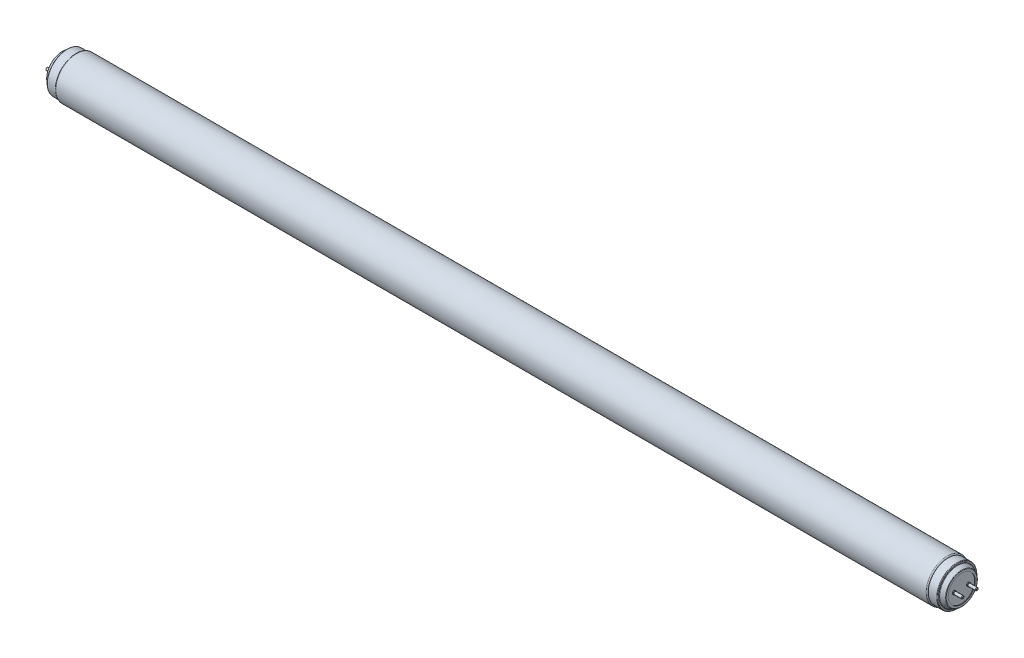
from build123d import *

# Parameters (mm, degrees)
SKETCH2_R      = 1.2
EXTRUDE1_DEPTH = 8
SKETCH3_R      = 1.5
EXTRUDE2_DEPTH = 1
EXTRUDE3_START = 8
SKETCH4_R      = 1.2
EXTRUDE3_DEPTH = 8
EXTRUDE4_START = 1
SKETCH5_R      = 1.5
EXTRUDE4_DEPTH = 1
CHAMFER1_SIZE  = 0.3
CHAMFER2_SIZE  = 0.5


with BuildPart() as part:
    # Sketch1 → Revolve1 (revolve)
    with BuildSketch(Plane.XY, mode=Mode.PRIVATE) as revolve1_sk:
        with BuildLine():
            Line((0, -17.75), (-7.5, -17.75))
            ThreePointArc((-7.5, -17.75), (-7.853553391, -17.603553391), (-8, -17.25))
            Line((-8, -17.25), (-8, -16.309016994))
            ThreePointArc((-8, -16.309016994), (-8.074674596, -16.046151438), (-8.276393202, -15.861803399))
            Line((-8.276393202, -15.861803399), (-11.723606798, -14.138196601))
            ThreePointArc((-11.723606798, -14.138196601), (-11.925325404, -13.953848562), (-12, -13.690983006))
            Line((-12, -13.690983006), (-12, -12))
            Line((-12, -12), (-11.5, -12))
            Line((-11.5, -12), (-11.5, 0))
            Line((-11.5, 0), (0, 0))
            Line((0, 0), (776, 0))
            Line((776, 0), (787.5, 0))
            Line((787.5, 0), (787.5, -12))
            Line((787.5, -12), (788, -12))
            Line((788, -12), (788, -13.690983006))
            ThreePointArc((788, -13.690983006), (787.925325404, -13.953848562), (787.723606798, -14.138196601))
            Line((787.723606798, -14.138196601), (784.276393202, -15.861803399))
            ThreePointArc((784.276393202, -15.861803399), (784.074674596, -16.046151438), (784, -16.309016994))
            Line((784, -16.309016994), (784, -17.25))
            ThreePointArc((784, -17.25), (783.853553391, -17.603553391), (783.5, -17.75))
            Line((783.5, -17.75), (776, -17.75))
            ThreePointArc((776, -17.75), (775.721751442, -18.421751442), (775.05, -18.7))
            Line((775.05, -18.7), (0.95, -18.7))
            ThreePointArc((0.95, -18.7), (0.278248558, -18.421751442), (0, -17.75))
        make_face()
    revolve(revolve1_sk.sketch.rotate(Axis((-11.5, 0, 0), (-1, 0, 0)), 270), axis=Axis((-11.5, 0, 0), (-1, 0, 0)))

    # Sketch2 → Extrude1 (add)
    with BuildSketch(Plane.ZY.offset(11.5)):
        with Locations(Location((-6.3, 0, 0), (0, 0, 180))):
            Circle(SKETCH2_R)
        with Locations(Location((6.3, 0, 0), (0, 0, 180))):
            Circle(SKETCH2_R)
    extrude(amount=EXTRUDE1_DEPTH)

    # Sketch3 → Extrude2 (add)
    with BuildSketch(Plane.ZY.offset(11.5)):
        with Locations(Location((-6.3, 0, 0), (0, 0, 180))):
            Circle(SKETCH3_R)
        with Locations(Location((6.3, 0, 0), (0, 0, 180))):
            Circle(SKETCH3_R)
    extrude(amount=EXTRUDE2_DEPTH)

    # Sketch4 → Extrude3 (add)
    with BuildSketch(Plane(origin=(787.5, 0, 0), x_dir=(0, 0, -1), z_dir=(1, 0, 0)).offset(EXTRUDE3_START)):
        with Locations(Location((6.3, 0, 0), (0, 0, 180))):
            Circle(SKETCH4_R)
        with Locations(Location((-6.3, 0, 0), (0, 0, 180))):
            Circle(SKETCH4_R)
    extrude(amount=-EXTRUDE3_DEPTH)

    # Sketch5 → Extrude4 (add)
    with BuildSketch(Plane(origin=(787.5, 0, 0), x_dir=(0, 0, -1), z_dir=(1, 0, 0)).offset(EXTRUDE4_START)):
        with Locations((6.3, 0)):
            Circle(SKETCH5_R)
        with Locations((-6.3, 0)):
            Circle(SKETCH5_R)
    extrude(amount=-EXTRUDE4_DEPTH)

    # Chamfer1
    chamfer1_edges = [part.edges().sort_by_distance(p)[0] for p in [
        (-12.5, 0, -4.8),
        (-12.5, 0, 7.8),
        (788.5, 0, -4.8),
        (788.5, 0, 7.8),
    ]]
    chamfer(chamfer1_edges, length=CHAMFER1_SIZE - 0.0001)  # a hair under: the kernel refuses the full size

    # Chamfer2
    chamfer2_edges = [part.edges().sort_by_distance(p)[0] for p in [
        (-19.5, 0, -5.1),
        (-19.5, 0, 7.5),
        (795.5, 0, -7.5),
        (795.5, 0, 5.1),
    ]]
    chamfer(chamfer2_edges, length=CHAMFER2_SIZE)


solid = part.part
